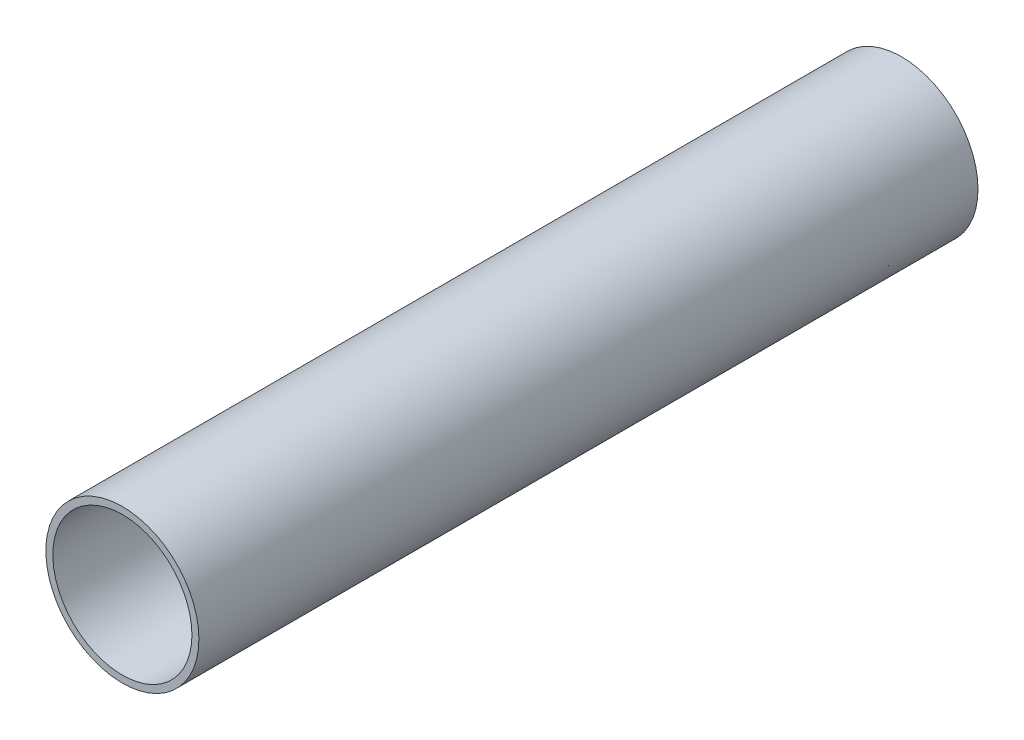
from build123d import *

# Parameters (mm, degrees)
ESQUISSE1_R                    = 5.5
ESQUISSE1_R_2                  = 5
BOSS_EXTRU_1_DEPTH             = 28
BOSS_EXTRU_2_REACH             = 31.06
ESQUISSE2_R                    = 1
BOSS_EXTRU_2_DIRECTION_2_REACH = 31.06


with BuildPart() as part:
    # Esquisse1 → Boss.-Extru.1 (new, symmetric)
    with BuildSketch(Plane.XY):
        Circle(ESQUISSE1_R)
        Circle(ESQUISSE1_R_2, mode=Mode.SUBTRACT)
    extrude(amount=BOSS_EXTRU_1_DEPTH, both=True)

    # Esquisse2 → Boss.-Extru.2 (add, up to next)
    with BuildSketch(Plane(origin=(0, 0, 0), x_dir=(1, 0, 0), z_dir=(0, 1, 0)), mode=Mode.PRIVATE) as boss_extru_2_sk1:
        with Locations((0, -19.5)):
            Circle(ESQUISSE2_R)
    boss_extru_2_tool1 = extrude(boss_extru_2_sk1.sketch, amount=BOSS_EXTRU_2_REACH, mode=Mode.PRIVATE) - part.part
    # Esquisse2 → Boss.-Extru.2 (add, up to next)
    with BuildSketch(Plane(origin=(0, 0, 0), x_dir=(1, 0, 0), z_dir=(0, 1, 0)), mode=Mode.PRIVATE) as boss_extru_2_sk2:
        with Locations((0, 27)):
            Circle(ESQUISSE2_R)
    boss_extru_2_tool2 = extrude(boss_extru_2_sk2.sketch, amount=BOSS_EXTRU_2_REACH, mode=Mode.PRIVATE) - part.part
    add(boss_extru_2_tool1.solids().sort_by_distance((0, 0, 19.5))[0])
    add(boss_extru_2_tool2.solids().sort_by_distance((0, 0, -27))[0])

    # Esquisse2 → Boss.-Extru.2 direction 2 (add, up to next)
    with BuildSketch(Plane(origin=(0, 0, 0), x_dir=(1, 0, 0), z_dir=(0, 1, 0)), mode=Mode.PRIVATE) as boss_extru_2_direction_2_sk1:
        with Locations((0, -19.5)):
            Circle(ESQUISSE2_R)
    boss_extru_2_direction_2_tool1 = extrude(boss_extru_2_direction_2_sk1.sketch, amount=-BOSS_EXTRU_2_DIRECTION_2_REACH, mode=Mode.PRIVATE) - part.part
    # Esquisse2 → Boss.-Extru.2 direction 2 (add, up to next)
    with BuildSketch(Plane(origin=(0, 0, 0), x_dir=(1, 0, 0), z_dir=(0, 1, 0)), mode=Mode.PRIVATE) as boss_extru_2_direction_2_sk2:
        with Locations((0, 27)):
            Circle(ESQUISSE2_R)
    boss_extru_2_direction_2_tool2 = extrude(boss_extru_2_direction_2_sk2.sketch, amount=-BOSS_EXTRU_2_DIRECTION_2_REACH, mode=Mode.PRIVATE) - part.part
    add(boss_extru_2_direction_2_tool1.solids().sort_by_distance((0, 0, 19.5))[0])
    add(boss_extru_2_direction_2_tool2.solids().sort_by_distance((0, 0, -27))[0])


solid = part.part
